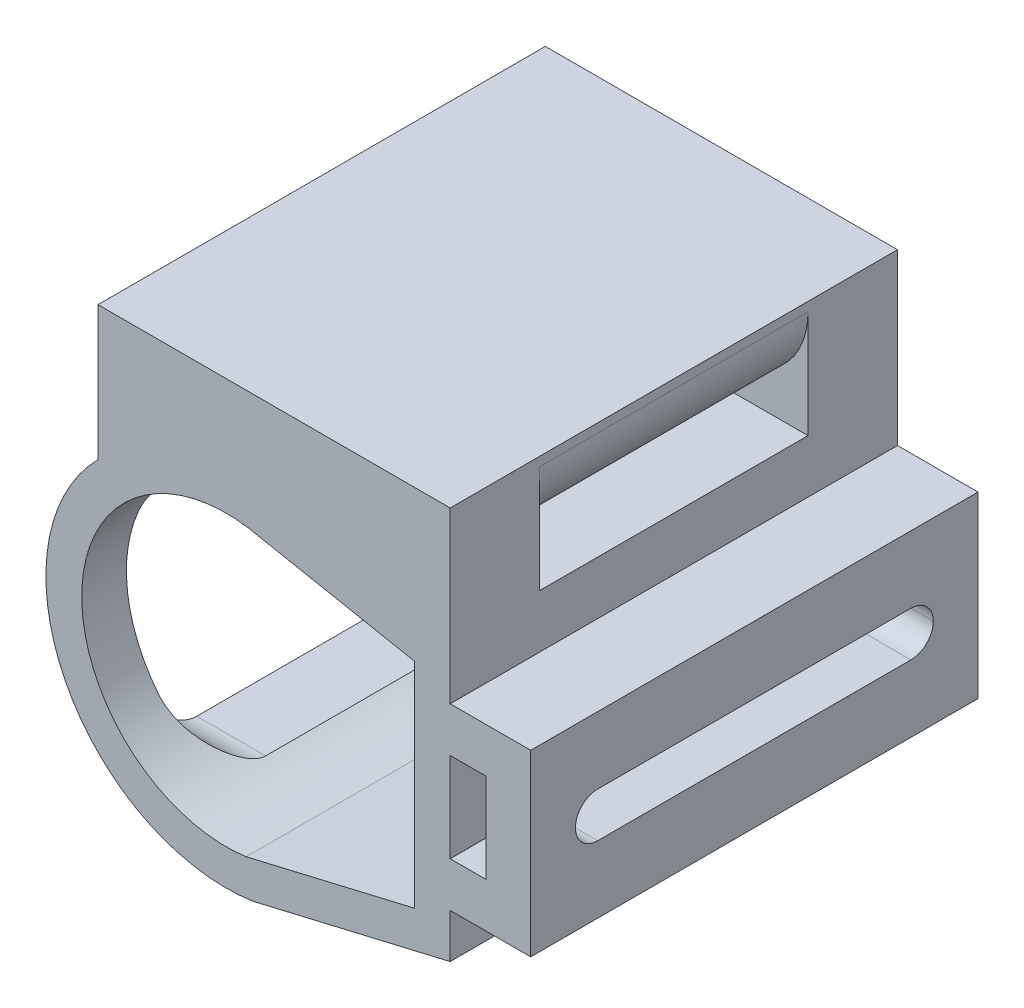
from build123d import *

# Parameters (mm, degrees)
SALIENTE_EXTRUIR1_DEPTH = 50
SALIENTE_EXTRUIR2_DEPTH = 50
CORTAR_EXTRUIR12_REACH  = 81.477
CROQUIS12_W             = 40
CROQUIS12_H             = 5
REDONDEO1_R             = 2.5
CROQUIS16_W             = 40
CROQUIS16_H             = 26.726230184
CORTAR_EXTRUIR17_DEPTH  = 20
REDONDEO2_R             = 5
CORTAR_EXTRUIR18_REACH  = 77.626
CROQUIS21_W             = 30
CROQUIS21_H             = 3
REDONDEO3_R             = 9


with BuildPart() as part:
    # Croquis3 → Saliente-Extruir1 (new body)
    with BuildSketch(Plane.XY):
        with BuildLine():
            Line((-4.157247249, -24.2640649), (-26.215773458, -29.447511872))
            ThreePointArc((-26.215773458, -29.447511872), (-47.164183017, -18.638090647), (-43.521067646, 4.65154569))
            Line((-43.521067646, 4.65154569), (-43.521067646, 19.65154569))
            Line((-43.521067646, 19.65154569), (-4.157247249, 19.65154569))
            Line((-4.157247249, 19.65154569), (-4.157247249, -24.2640649))
        make_face()
        with BuildLine():
            Line((-8.157247249, 2.82108494), (-26.731262437, 6.441781026))
            ThreePointArc((-26.731262437, 6.441781026), (-45.345288804, -9.402744466), (-26.961453667, -25.513783269))
            Line((-26.961453667, -25.513783269), (-8.157247249, -21.095056202))
            Line((-8.157247249, -21.095056202), (-8.157247249, 2.82108494))
        make_face(mode=Mode.SUBTRACT)
    extrude(amount=SALIENTE_EXTRUIR1_DEPTH)

    # Croquis11 → Saliente-Extruir2 (add)
    with BuildSketch(Plane(origin=(0, 0, 0), x_dir=(-1, 0, 0), z_dir=(0, 0, -1))):
        Polygon((-4.842752751, -19.306259605), (-4.842752751, 0.693740395), (4.157247249, 0.693740395), (4.157247249, -4.306259605), (0.157247249, -4.306259605), (0.157247249, -14.306259605), (4.157247249, -14.306259605), (4.157247249, -19.306259605), align=None)
    extrude(amount=-SALIENTE_EXTRUIR2_DEPTH)

    # Cortar-Extruir12: up to this face of the body (flat: up to its plane)
    cortar_extruir12_end = Plane(part.part.faces().sort_by_distance((-8.157247249, -9.136985631, 25))[0])
    # Croquis12 → Cortar-Extruir12 (cut, up to the picked face)
    with BuildSketch(Plane(origin=(4.842752751, 0, 0), x_dir=(0, 0, -1), z_dir=(1, 0, 0)), mode=Mode.PRIVATE) as cortar_extruir12_sk1:
        with Locations((-25, -9.306259605)):
            Rectangle(CROQUIS12_W, CROQUIS12_H)
    cortar_extruir12_tool1 = split(extrude(cortar_extruir12_sk1.sketch, amount=-CORTAR_EXTRUIR12_REACH, mode=Mode.PRIVATE), bisect_by=cortar_extruir12_end, keep=Keep.BOTH, mode=Mode.PRIVATE)
    add(cortar_extruir12_tool1.solids().sort_by(Axis((4.842753, -9.30626, 25), (-1, 0, 0)))[0], mode=Mode.SUBTRACT)

    # Redondeo1
    redondeo1_edges = [part.edges().sort_by_distance(p)[0] for p in [
        (2.342752751, -6.806259605, 5),
        (2.342752751, -6.806259605, 45),
        (-6.157247249, -11.806259605, 5),
        (-6.157247249, -6.806259605, 5),
        (-6.157247249, -11.806259605, 45),
        (-6.157247249, -6.806259605, 45),
        (2.342752751, -11.806259605, 5),
        (2.342752751, -11.806259605, 45),
    ]]
    fillet(redondeo1_edges, radius=REDONDEO1_R - 0.0001)  # a hair under: the kernel refuses the full size

    # Croquis16 → Cortar-Extruir17 (cut, symmetric)
    with BuildSketch(Plane.ZY.offset(48.157247249)):
        with Locations((25, -11.305962539)):
            Rectangle(CROQUIS16_W, CROQUIS16_H)
    extrude(amount=CORTAR_EXTRUIR17_DEPTH, both=True, mode=Mode.SUBTRACT)

    # Redondeo2
    redondeo2_edges = [part.edges().sort_by_distance(p)[0] for p in [
        (-43.072694771, 2.057152553, 45),
        (-38.635693074, -24.669077631, 45),
        (-38.635693074, -24.669077631, 5),
        (-43.072694771, 2.057152553, 5),
    ]]
    fillet(redondeo2_edges, radius=REDONDEO2_R)

    # Croquis21 → Cortar-Extruir18 (cut, up to next)
    with BuildSketch(Plane.ZY.offset(43.521067646), mode=Mode.PRIVATE) as cortar_extruir18_sk1:
        with Locations((25, 8.15154569)):
            Rectangle(CROQUIS21_W, CROQUIS21_H)
    cortar_extruir18_tool1 = extrude(cortar_extruir18_sk1.sketch, amount=-CORTAR_EXTRUIR18_REACH, mode=Mode.PRIVATE) & part.part
    add(cortar_extruir18_tool1.solids().sort_by_distance((-43.521068, 8.151546, 25))[0], mode=Mode.SUBTRACT)

    # Redondeo3
    redondeo3_edges = [part.edges().sort_by_distance(p)[0] for p in [
        (-43.521067646, 9.65154569, 25),
        (-4.157247249, 9.65154569, 25),
    ]]
    fillet(redondeo3_edges, radius=REDONDEO3_R)


solid = part.part
